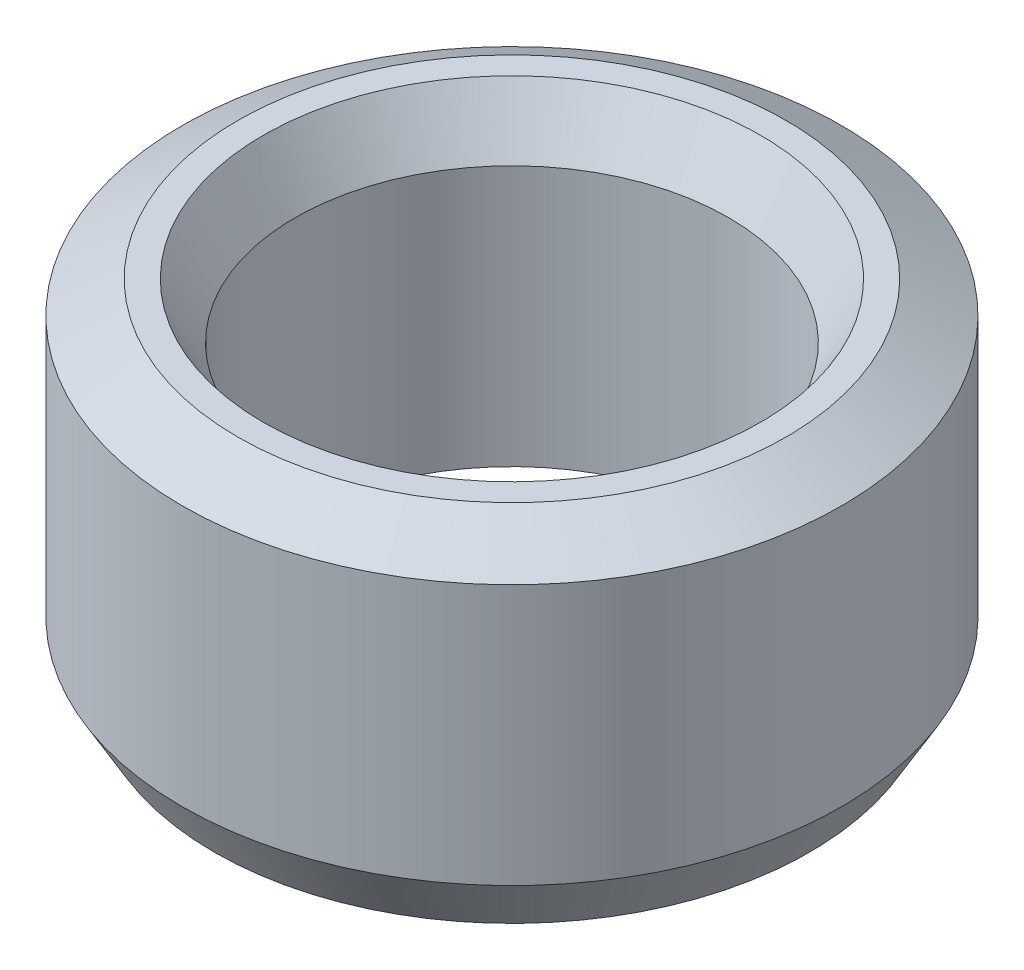
from build123d import *
from OCP.BRepFilletAPI import BRepFilletAPI_MakeChamfer

# Parameters (mm, degrees)
SKETCH1_R           = 35
BOSS_EXTRUDE1_DEPTH = 36.942623567
SKETCH2_R           = 23.012264769
CUT_EXTRUDE1_DEPTH  = 62.763722654
CHAMFER1_SIZE       = 3.394586508
CHAMFER1_SIZE2      = 5.879596303


with BuildPart() as part:
    # Sketch1 → Boss-Extrude1 (new body)
    with BuildSketch(Plane(origin=(0, 0, 0), x_dir=(1, 0, 0), z_dir=(0, 1, 0))):
        Circle(SKETCH1_R)
    extrude(amount=BOSS_EXTRUDE1_DEPTH)

    # Sketch2 → Cut-Extrude1 (cut, through all)
    with BuildSketch(Plane(origin=(0, 0, 0), x_dir=(1, 0, 0), z_dir=(0, 1, 0))):
        Circle(SKETCH2_R)
    extrude(amount=CUT_EXTRUDE1_DEPTH, mode=Mode.SUBTRACT)

    # Chamfer1: one chamfer whose edges measure the first distance from different faces: ONE call of the kernel's chamfer builder (chamfer() names one face for all edges)
    chamfer1_edges_1 = [part.edges().sort_by_distance(p)[0] for p in [
        (-23.012264769, 36.942623567, 0),
    ]]
    chamfer1_side_1 = [part.faces().sort_by_distance(p)[0] for p in [
        (-34.010050506, 36.942623567, 0),
    ]]
    chamfer1_edges_2 = [part.edges().sort_by_distance(p)[0] for p in [
        (-23.012264769, 0, 0),
    ]]
    chamfer1_side_2 = [part.faces().sort_by_distance(p)[0] for p in [
        (-23.012264769, 18.471311784, 0),
    ]]
    chamfer1_edges_3 = [part.edges().sort_by_distance(p)[0] for p in [
        (-35, 0, 0),
    ]]
    chamfer1_side_3 = [part.faces().sort_by_distance(p)[0] for p in [
        (-34.010050506, 0, 0),
    ]]
    chamfer1_edges_4 = [part.edges().sort_by_distance(p)[0] for p in [
        (-35, 36.942623567, 0),
    ]]
    chamfer1_side_4 = [part.faces().sort_by_distance(p)[0] for p in [
        (-35, 18.471311784, 0),
    ]]
    chamfer1 = BRepFilletAPI_MakeChamfer(part.part.solid().wrapped)
    for e in chamfer1_edges_1:
        chamfer1.Add(CHAMFER1_SIZE, CHAMFER1_SIZE2, e.wrapped, chamfer1_side_1[0].wrapped)  # the first distance lies on this face
    for e in chamfer1_edges_2:
        chamfer1.Add(CHAMFER1_SIZE, CHAMFER1_SIZE2, e.wrapped, chamfer1_side_2[0].wrapped)  # the first distance lies on this face
    for e in chamfer1_edges_3:
        chamfer1.Add(CHAMFER1_SIZE, CHAMFER1_SIZE2, e.wrapped, chamfer1_side_3[0].wrapped)  # the first distance lies on this face
    for e in chamfer1_edges_4:
        chamfer1.Add(CHAMFER1_SIZE, CHAMFER1_SIZE2, e.wrapped, chamfer1_side_4[0].wrapped)  # the first distance lies on this face
    add(Compound.cast(chamfer1.Shape()), mode=Mode.REPLACE)


solid = part.part
